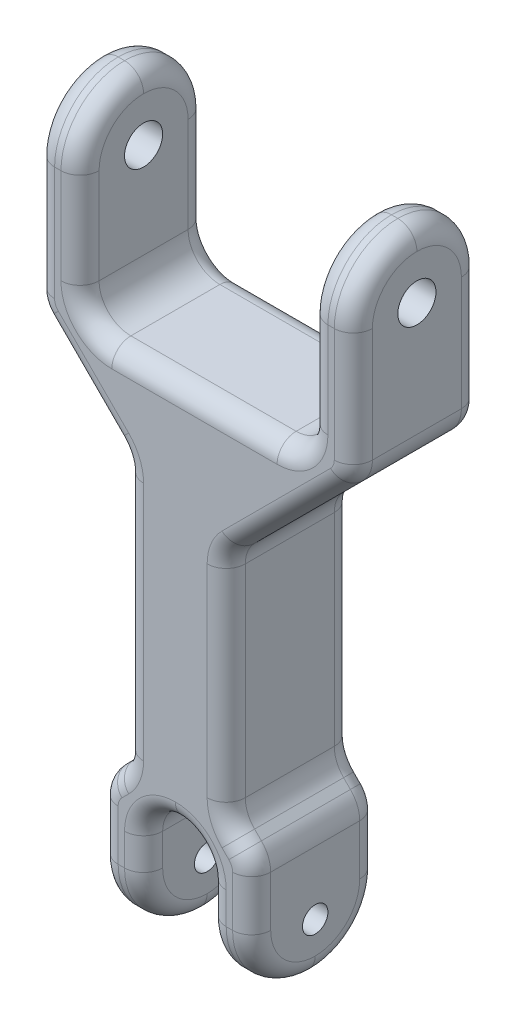
from build123d import *

# Parameters (mm, degrees)
BOSS_EXTRUDE1_DEPTH      = 10
BOSS_EXTRUDE1_DEPTH_BACK = 10
SKETCH2_R                = 3
SKETCH2_R_2              = 2
CUT_EXTRUDE1_DEPTH       = 50
FILLET4_R                = 10
FILLET5_R                = 5
FILLET6_R                = 5
FILLET9_R                = 10
FILLET10_R               = 5
FILLET11_R               = 3


with BuildPart() as part:
    # Sketch1 → Boss-Extrude1 (new, two sides: drawn at the far end of the back side and taken through both)
    with BuildSketch(Plane.XY.offset(-BOSS_EXTRUDE1_DEPTH_BACK)):
        Polygon((-15, 20), (-15, 0), (-8, 0), (-8, 20), (2, 20), (2, 0), (9, 0), (9, 20), (5, 24), (5, 60), (25, 80), (25, 110), (18, 110), (18, 80), (-18, 80), (-18, 110), (-25, 110), (-25, 80), (-11, 66), (-11, 24), align=None)
    extrude(amount=BOSS_EXTRUDE1_DEPTH + BOSS_EXTRUDE1_DEPTH_BACK)

    # Sketch2 → Cut-Extrude1 (cut)
    with BuildSketch(Plane(origin=(25, 0, 0), x_dir=(0, 0, -1), z_dir=(1, 0, 0))):
        with Locations(Location((0, 100, 0), (0, 0, 90))):
            Circle(SKETCH2_R)
        with Locations((0, 8)):
            Circle(SKETCH2_R_2)
    extrude(amount=-CUT_EXTRUDE1_DEPTH, mode=Mode.SUBTRACT)

    # Fillet4
    fillet4_edges = [part.edges().sort_by_distance(p)[0] for p in [
        (-21.5, 110, -10),
        (-21.5, 110, 10),
        (21.5, 110, -10),
        (21.5, 110, 10),
    ]]
    fillet(fillet4_edges, radius=FILLET4_R - 0.0001)  # a hair under: the kernel refuses the full size

    # Fillet5
    fillet5_edges = [part.edges().sort_by_distance(p)[0] for p in [
        (-18, 80, 0),
        (18, 80, 0),
    ]]
    fillet(fillet5_edges, radius=FILLET5_R)

    # Fillet6
    fillet6_edges = [part.edges().sort_by_distance(p)[0] for p in [
        (-15, 20, 0),
        (-11, 24, 0),
        (-11, 66, 0),
        (-25, 80, 0),
        (25, 80, 0),
        (5, 60, 0),
        (5, 24, 0),
        (9, 20, 0),
    ]]
    fillet(fillet6_edges, radius=FILLET6_R)

    # Fillet9
    fillet9_edges = [part.edges().sort_by_distance(p)[0] for p in [
        (-11.5, 0, -10),
        (-11.5, 0, 10),
        (5.5, 0, -10),
        (5.5, 0, 10),
    ]]
    fillet(fillet9_edges, radius=FILLET9_R - 0.0001)  # a hair under: the kernel refuses the full size

    # Fillet10
    fillet10_edges = [part.edges().sort_by_distance(p)[0] for p in [
        (-8, 20, 0),
        (2, 20, 0),
    ]]
    fillet(fillet10_edges, radius=FILLET10_R - 0.0001)  # a hair under: the kernel refuses the full size

    # Fillet11
    fillet11_edges = [part.edges().sort_by_distance(p)[0] for p in [
        (18, 107.071097101, 7.071097101),
        (18, 107.071097101, -7.071097101),
        (18, 92.50005, -10),
        (16.535533906, 81.464466094, -10),
        (0, 80, -10),
        (-16.535533906, 81.464466094, -10),
        (-18, 92.50005, -10),
        (-18, 107.071097101, -7.071097101),
        (-18, 107.071097101, 7.071097101),
        (25, 107.071097101, 7.071097101),
        (25, 107.071097101, -7.071097101),
        (25, 91.035583906, -10),
        (24.619397663, 80.15765065, -10),
        (15, 70, -10),
        (5.380602337, 59.84234935, -10),
        (5, 42, -10),
        (5.380602337, 24.15765065, -10),
        (7, 22, -10),
        (8.619397663, 19.84234935, -10),
        (9, 13.964416094, -10),
        (9, 2.928902899, -7.071097101),
        (9, 2.928902899, 7.071097101),
        (-8, 2.928902899, 7.071097101),
        (-8, 2.928902899, -7.071097101),
        (-8, 12.5, -10),
        (-6.535563195, 18.535563195, -10),
        (0.535563195, 18.535563195, -10),
        (2, 12.5, -10),
        (2, 2.928902899, -7.071097101),
        (2, 2.928902899, 7.071097101),
        (-15, 2.928902899, 7.071097101),
        (-15, 2.928902899, -7.071097101),
        (-15, 13.964416094, -10),
        (-14.619397663, 19.84234935, -10),
        (-13, 22, -10),
        (-11.380602337, 24.15765065, -10),
        (-11, 45, -10),
        (-11.380602337, 65.84234935, -10),
        (-18, 73, -10),
        (-24.619397663, 80.15765065, -10),
        (-25, 91.035583906, -10),
        (-25, 107.071097101, -7.071097101),
        (-25, 107.071097101, 7.071097101),
        (-14.619397663, 19.84234935, 10),
        (-13, 22, 10),
        (-11.380602337, 24.15765065, 10),
        (-11, 45, 10),
        (-11.380602337, 65.84234935, 10),
        (-18, 73, 10),
        (-24.619397663, 80.15765065, 10),
        (-25, 91.035583906, 10),
        (-18, 92.50005, 10),
        (-16.535533906, 81.464466094, 10),
        (0, 80, 10),
        (16.535533906, 81.464466094, 10),
        (18, 92.50005, 10),
        (25, 91.035583906, 10),
        (24.619397663, 80.15765065, 10),
        (15, 70, 10),
        (5.380602337, 59.84234935, 10),
        (5, 42, 10),
        (5.380602337, 24.15765065, 10),
        (7, 22, 10),
        (8.619397663, 19.84234935, 10),
        (9, 13.964416094, 10),
        (2, 12.5, 10),
        (0.535563195, 18.535563195, 10),
        (-6.535563195, 18.535563195, 10),
        (-8, 12.5, 10),
        (-15, 13.964416094, 10),
    ]]
    fillet(fillet11_edges, radius=FILLET11_R)


solid = part.part
